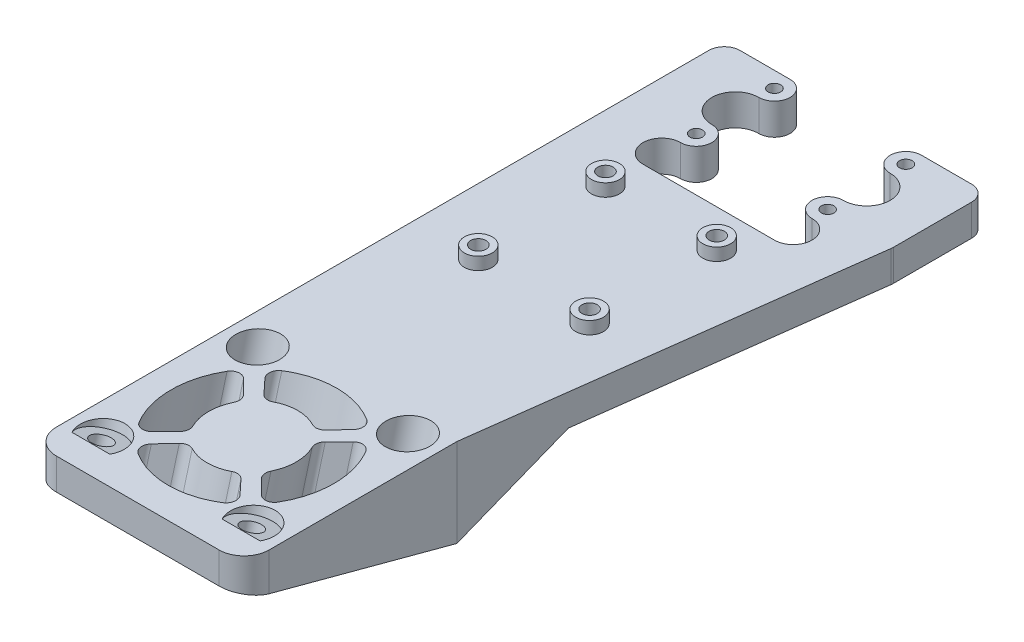
from build123d import *

# Parameters (mm, degrees)
SKETCH1_R                = 1
BOSS_EXTRUDE1_DEPTH      = 5
BOSS_EXTRUDE3_START      = -36.049668807
BOSS_EXTRUDE3_DEPTH      = 36.049668807
BOSS_EXTRUDE3_START_2    = -10
BOSS_EXTRUDE3_2_DEPTH    = 10
SKETCH7_R                = 1.6
CUT_EXTRUDE3_DEPTH       = 99.561878238
SKETCH8_R                = 3.5
CUT_EXTRUDE4_DEPTH       = 98.211785554
FILLET1_R                = 4
CUT_EXTRUDE1_DEPTH       = 99.633430775
FILLET2_R                = 1.5
CIRPATTERN1_COUNT        = 4
FILLET2_OF_CIRPATTERN1_R = 1.5
SKETCH3_R                = 1.225
CUT_EXTRUDE2_DEPTH       = 99.04673524
SKETCH3_3_R              = 2.225
SKETCH3_3_R_2            = 1.225
BOSS_EXTRUDE2_DEPTH      = 2
BOSS_EXTRUDE2_2_DEPTH    = 2
BOSS_EXTRUDE2_3_DEPTH    = 2
BOSS_EXTRUDE2_4_DEPTH    = 2


with BuildPart() as part:
    # Sketch1 → Boss-Extrude1 (new body)
    with BuildSketch(Plane(origin=(0, 0, 0), x_dir=(1, 0, 0), z_dir=(0, 1, 0))):
        with BuildLine():
            Line((17, -17), (17, 17))
            Line((17, 17), (24.979172378, 78.427968452))
            ThreePointArc((24.979172378, 78.427968452), (24.994787661, 78.588647817), (25, 78.75))
            Line((25, 78.75), (25, 91.25))
            ThreePointArc((25, 91.25), (24.267766953, 93.017766953), (22.5, 93.75))
            Line((22.5, 93.75), (14.5, 93.75))
            ThreePointArc((14.5, 93.75), (12, 91.25), (14.5, 88.75))
            ThreePointArc((14.5, 88.75), (18.25, 85), (14.5, 81.25))
            ThreePointArc((14.5, 81.25), (12, 78.75), (14.5, 76.25))
            ThreePointArc((14.5, 76.25), (17.5, 73.25), (14.5, 70.25))
            Line((14.5, 70.25), (-6.5, 70.25))
            ThreePointArc((-6.5, 70.25), (-9.5, 73.25), (-6.5, 76.25))
            ThreePointArc((-6.5, 76.25), (-4, 78.75), (-6.5, 81.25))
            ThreePointArc((-6.5, 81.25), (-10.25, 85), (-6.5, 88.75))
            ThreePointArc((-6.5, 88.75), (-4, 91.25), (-6.5, 93.75))
            Line((-6.5, 93.75), (-14.5, 93.75))
            ThreePointArc((-14.5, 93.75), (-16.267766953, 93.017766953), (-17, 91.25))
            Line((-17, 91.25), (-17, -17))
            Line((-17, -17), (17, -17))
        make_face()
        with Locations(Location((-6.5, 78.75, 0), (0, 0, 270))):
            Circle(SKETCH1_R, mode=Mode.SUBTRACT)
        with Locations(Location((-6.5, 91.25, 0), (0, 0, 270))):
            Circle(SKETCH1_R, mode=Mode.SUBTRACT)
        with Locations(Location((14.5, 78.75, 0), (0, 0, 270))):
            Circle(SKETCH1_R, mode=Mode.SUBTRACT)
        with Locations(Location((14.5, 91.25, 0), (0, 0, 270))):
            Circle(SKETCH1_R, mode=Mode.SUBTRACT)
    extrude(amount=BOSS_EXTRUDE1_DEPTH)

    # Boss-Extrude3: read off the stored shape, not the designer's step
    # Boss-Extrude3 outline → Boss-Extrude3 (add)
    with BuildSketch(Plane.ZY.offset(17).offset(BOSS_EXTRUDE3_START)):
        Polygon((-32.779454915, 0), (-17, -9.110272543), (17, 0), align=None)
    extrude(amount=BOSS_EXTRUDE3_DEPTH)

    # Boss-Extrude3 2 outline → Boss-Extrude3 2 (cut)
    with BuildSketch(Plane(origin=(0, 0, 0), x_dir=(1, 0, 0), z_dir=(0, 1, 0)).offset(BOSS_EXTRUDE3_START_2)):
        Polygon((19.049668807, 32.779454915), (17, 17), (17, -18), (19.049668807, -18), align=None)
    extrude(amount=BOSS_EXTRUDE3_2_DEPTH, mode=Mode.SUBTRACT)

    # Sketch7 → Cut-Extrude3 (cut, through all)
    with BuildSketch(Plane(origin=(0, -4.25, 1.138784068), x_dir=(1, 0, 0), z_dir=(0, -0.96592582628907, 0.25881904510251447))):
        with Locations(Location((-12, 11.591109915, 0), (0, 0, 270))):
            Circle(SKETCH7_R)
        with Locations(Location((12, 11.591109915, 0), (0, 0, 270))):
            Circle(SKETCH7_R)
        with Locations(Location((12, -12.408890085, 0), (0, 0, 270))):
            Circle(SKETCH7_R)
        with Locations(Location((-12, -12.408890085, 0), (0, 0, 270))):
            Circle(SKETCH7_R)
    extrude(amount=-CUT_EXTRUDE3_DEPTH, mode=Mode.SUBTRACT)

    # Sketch8 → Cut-Extrude4 (cut, through all)
    with BuildSketch(Plane(origin=(0, 1.545554958, -0.414130203), x_dir=(-1, 0, 0), z_dir=(0, -0.96592582628907, 0.25881904510251447))):
        with Locations(Location((-12, 12.408890085, 0), (0, 0, 90))):
            Circle(SKETCH8_R)
        with Locations(Location((12, 12.408890085, 0), (0, 0, 90))):
            Circle(SKETCH8_R)
        with Locations((12, -11.591109915)):
            Circle(SKETCH8_R)
        with Locations((-12, -11.591109915)):
            Circle(SKETCH8_R)
    extrude(amount=-CUT_EXTRUDE4_DEPTH, mode=Mode.SUBTRACT)

    # Fillet1
    fillet1_edges = [part.edges().sort_by_distance(p)[0] for p in [
        (17, 2.5, 17),
        (-17, 2.5, 17),
    ]]
    fillet(fillet1_edges, radius=FILLET1_R)

    # Sketch2 → Cut-Extrude1 (cut, symmetric)
    with BuildSketch(Plane(origin=(0, -4.229552898, 1.215093691), x_dir=(1, 0, 0), z_dir=(0, 0.96592582628907, -0.25881904510251447))):
        with BuildLine():
            ThreePointArc((8.291504335, 10.091541465), (0, 13.079001535), (-8.291504335, 10.091541465))
            Line((-8.291504335, 10.091541465), (-4.09738644, 5.754512468))
            ThreePointArc((-4.09738644, 5.754512468), (0, 7.079001535), (4.09738644, 5.754512468))
            Line((4.09738644, 5.754512468), (8.291504335, 10.091541465))
        make_face()
    cut_extrude1 = extrude(amount=CUT_EXTRUDE1_DEPTH, both=True, mode=Mode.SUBTRACT)

    # Fillet2
    fillet2_edges = [part.edges().sort_by_distance(p)[0] for p in [
        (-4.09738644, -0.35946516, -5.779402882),
        (8.291504335, -0.920718012, -10.119038447),
        (4.09738644, -0.35946516, -5.779402882),
        (-8.291504335, -0.920718012, -10.119038447),
    ]]
    fillet(fillet2_edges, radius=FILLET2_R)

    # CirPattern1: Cut-Extrude1 ×4 about axis
    cirpattern1_axis = Axis((0, 0, 0), (0, 0.96592582628907, -0.25881904510251447))
    for i in range(1, CIRPATTERN1_COUNT):
        add(cut_extrude1.rotate(cirpattern1_axis, i * 360 / CIRPATTERN1_COUNT), mode=Mode.SUBTRACT)

    # Fillet2 of CirPattern1
    fillet2_of_cirpattern1_edges = [part.edges().sort_by_distance(p)[0] for p in [
        (-5.675510934, 2.169946806, 3.660491089),
        (-10.01253993, -0.475281223, -8.456645718),
        (-5.675510934, 0.048983514, -4.255051677),
        (-10.01253993, 3.816717246, 7.561310634),
        (4.09738644, 2.57839548, 5.184842294),
        (-8.291504335, 4.262154036, 9.223703363),
        (-4.09738644, 2.57839548, 5.184842294),
        (8.291504335, 4.262154036, 9.223703363),
        (5.675510934, 0.048983514, -4.255051677),
        (10.01253993, 3.816717246, 7.561310634),
        (5.675510934, 2.169946806, 3.660491089),
        (10.01253993, -0.475281223, -8.456645718),
    ]]
    fillet(fillet2_of_cirpattern1_edges, radius=FILLET2_OF_CIRPATTERN1_R)

    # Sketch3 → Cut-Extrude2 (cut, through all)
    with BuildSketch(Plane(origin=(0, 5, 0), x_dir=(1, 0, 0), z_dir=(0, 1, 0))):
        with Locations(Location((-6.5, 64.25, 0), (0, 0, 270))):
            Circle(SKETCH3_R)
        with Locations(Location((11.28, 64.25, 0), (0, 0, 270))):
            Circle(SKETCH3_R)
        with Locations(Location((11.28, 43.93, 0), (0, 0, 270))):
            Circle(SKETCH3_R)
        with Locations(Location((-6.5, 43.93, 0), (0, 0, 270))):
            Circle(SKETCH3_R)
    extrude(amount=-CUT_EXTRUDE2_DEPTH, mode=Mode.SUBTRACT)


with BuildPart() as body_2:
    # Sketch3<3> → Boss-Extrude2 (new body)
    with BuildSketch(Plane(origin=(0, 5, 0), x_dir=(1, 0, 0), z_dir=(0, 1, 0))):
        with Locations(Location((-6.5, 64.25, 0), (0, 0, 270))):
            Circle(SKETCH3_3_R)
        with Locations(Location((-6.5, 64.25, 0), (0, 0, 270))):
            Circle(SKETCH3_3_R_2, mode=Mode.SUBTRACT)
    extrude(amount=BOSS_EXTRUDE2_DEPTH)


with BuildPart() as body_3:
    # Sketch3<3> → Boss-Extrude2 2 (new body)
    with BuildSketch(Plane(origin=(0, 5, 0), x_dir=(1, 0, 0), z_dir=(0, 1, 0))):
        with Locations(Location((11.28, 64.25, 0), (0, 0, 270))):
            Circle(SKETCH3_3_R)
        with Locations(Location((11.28, 64.25, 0), (0, 0, 270))):
            Circle(SKETCH3_3_R_2, mode=Mode.SUBTRACT)
    extrude(amount=BOSS_EXTRUDE2_2_DEPTH)


with BuildPart() as body_4:
    # Sketch3<3> → Boss-Extrude2 3 (new body)
    with BuildSketch(Plane(origin=(0, 5, 0), x_dir=(1, 0, 0), z_dir=(0, 1, 0))):
        with Locations(Location((11.28, 43.93, 0), (0, 0, 270))):
            Circle(SKETCH3_3_R)
        with Locations(Location((11.28, 43.93, 0), (0, 0, 270))):
            Circle(SKETCH3_3_R_2, mode=Mode.SUBTRACT)
    extrude(amount=BOSS_EXTRUDE2_3_DEPTH)


with BuildPart() as body_5:
    # Sketch3<3> → Boss-Extrude2 4 (new body)
    with BuildSketch(Plane(origin=(0, 5, 0), x_dir=(1, 0, 0), z_dir=(0, 1, 0))):
        with Locations(Location((-6.5, 43.93, 0), (0, 0, 270))):
            Circle(SKETCH3_3_R)
        with Locations(Location((-6.5, 43.93, 0), (0, 0, 270))):
            Circle(SKETCH3_3_R_2, mode=Mode.SUBTRACT)
    extrude(amount=BOSS_EXTRUDE2_4_DEPTH)


solid = Compound([part.part, body_2.part, body_3.part, body_4.part, body_5.part])
